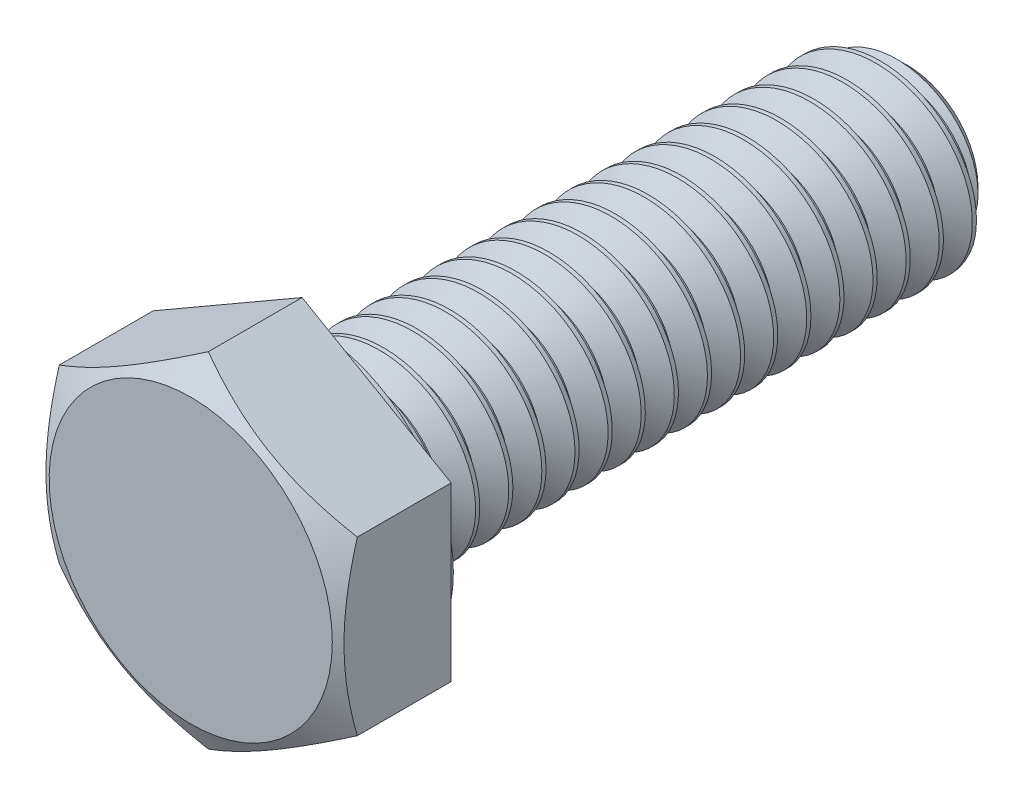
from build123d import *

# Parameters (mm, degrees)
SKETCH4_OUTSIDE_W  = 24.05
SKETCH4_OUTSIDE_H  = 24.05
CUT_EXTRUDE1_DEPTH = 33.270761799
CUT_SWEEP1_PITCH   = 1.411111111
CUT_SWEEP1_TO      = 25.4


with BuildPart() as part:
    # Sketch3 → Revolve1 (revolve)
    with BuildSketch(Plane(origin=(0, 0, 0), x_dir=(0, 0, -1), z_dir=(1, 0, 0)), mode=Mode.PRIVATE) as revolve1_sk:
        Polygon((-15.2796875, 0), (-15.2796875, 6.0325), (-14.529219666, 7.332348419), (-10.5330625, 7.332348419), (-10.5330625, 6.0325), (-10.1203125, 6.0325), (-10.1203125, 3.9751), (14.291909722, 3.9751), (15.2796875, 2.987322222), (15.2796875, 0), align=None)
    revolve(revolve1_sk.sketch.rotate(Axis((0, 0, 15.2796875), (0, 0, -1)), 90), axis=Axis((0, 0, 15.2796875), (0, 0, -1)))

    # Sketch4 outside → Cut-Extrude1 (cut, through all)
    with BuildSketch(Plane.XY.offset(15.2796875)):
        Rectangle(SKETCH4_OUTSIDE_W, SKETCH4_OUTSIDE_H)
        Polygon((6.35, 3.666174209), (0, 7.332348419), (-6.35, 3.666174209), (-6.35, -3.666174209), (0, -7.332348419), (6.35, -3.666174209), align=None, mode=Mode.SUBTRACT)
    extrude(amount=-CUT_EXTRUDE1_DEPTH, mode=Mode.SUBTRACT)


with BuildPart() as body_2:
    # Split1: the piece on the far side of the plane
    add(part.part)
    split(bisect_by=Plane(origin=(0, 0, 10.1203125), x_dir=(-1, 0, 0), z_dir=(0, 0, -1)), keep=Keep.BOTTOM)


with BuildPart() as part_1:
    add(part.part)

    # Split1
    split(bisect_by=Plane(origin=(0, 0, 10.1203125), x_dir=(-1, 0, 0), z_dir=(0, 0, -1)), keep=Keep.TOP)

    # Cut-Sweep1: arcs per turn and ends read off the stored shape
    # Cut-Sweep1: the profile of Sketch7 screwed along a right-hand helix through 19 turns, 8 arcs to a turn; built about Z, then put on its axis
    cut_sweep1_z = Axis((0, 0, 0), (0, 0, 1))
    cut_sweep1_corners = [(3.058556448, 0, -0.529166667), (3.058556448, 0, -0.705555556), (4.051478629, 0, -1.278819444), (4.051478629, 0, 0.044097222)]
    with BuildLine(mode=Mode.PRIVATE) as cut_sweep1_profile:
        Line(cut_sweep1_corners[0], cut_sweep1_corners[1])
        Line(cut_sweep1_corners[1], cut_sweep1_corners[2])
        Line(cut_sweep1_corners[2], cut_sweep1_corners[3])
        Line(cut_sweep1_corners[3], cut_sweep1_corners[0])
    cut_sweep1_cap = Face(cut_sweep1_profile.wire())
    cut_sweep1_turn_angles = [0, 22.5, 45, 67.5, 90, 112.5, 135, 157.5, 180, 202.5, 225, 247.5, 270, 292.5, 315, 337.5, 360]
    cut_sweep1_turn_weights = [1, 0.9238795325112867, 1, 0.9238795325112867, 1, 0.9238795325112867, 1, 0.9238795325112867, 1, 0.9238795325112867, 1, 0.9238795325112867, 1, 0.9238795325112867, 1, 0.9238795325112867, 1]
    cut_sweep1_turn_rails = [Edge.make_bspline([Vector(p[0], p[1], 0).rotate(cut_sweep1_z, cut_sweep1_turn_angles[k]) / cut_sweep1_turn_weights[k] + Vector(0, 0, p[2] + CUT_SWEEP1_PITCH * cut_sweep1_turn_angles[k] / 360) for k in range(17)], [0, 0, 0, 1, 1, 2, 2, 3, 3, 4, 4, 5, 5, 6, 6, 7, 7, 8, 8, 8], 2, cut_sweep1_turn_weights) for p in cut_sweep1_corners]
    cut_sweep1_turn_sides = [Face.make_surface_from_curves(cut_sweep1_turn_rails[p[0]], cut_sweep1_turn_rails[p[1]]) for p in [(0, 1), (1, 2), (2, 3), (3, 0)]]
    cut_sweep1 = Plane(origin=(0, 0, -15.2796875), x_dir=(0, 1, 0), z_dir=(0, 0, 1)) * split(Solid(Shell([*[p.moved(Location((0, 0, CUT_SWEEP1_PITCH * i))) for i in range(19) for p in cut_sweep1_turn_sides], cut_sweep1_cap, cut_sweep1_cap.rotate(cut_sweep1_z, 6840).moved(Location((0, 0, CUT_SWEEP1_PITCH * 6840 / 360)))])), bisect_by=Plane.XY.offset(CUT_SWEEP1_TO), keep=Keep.BOTTOM, mode=Mode.PRIVATE)
    add(cut_sweep1, mode=Mode.SUBTRACT)

    add(body_2.part)  # Boss-Extrude2 merges body 2
    # Boss-Extrude2 cone 1 section (through the dimple's axis) → Boss-Extrude2 (revolve)
    with BuildSketch(Plane(origin=(0, 0, 10.1203125), x_dir=(0, -1, 0), z_dir=(1, 0, 0))):
        Polygon((0, 0), (3.9751, 0), (0, 6.885075165), align=None)
    revolve(axis=Axis((0, 0, 10.1203125), (0, 0, -1)))


solid = part_1.part
